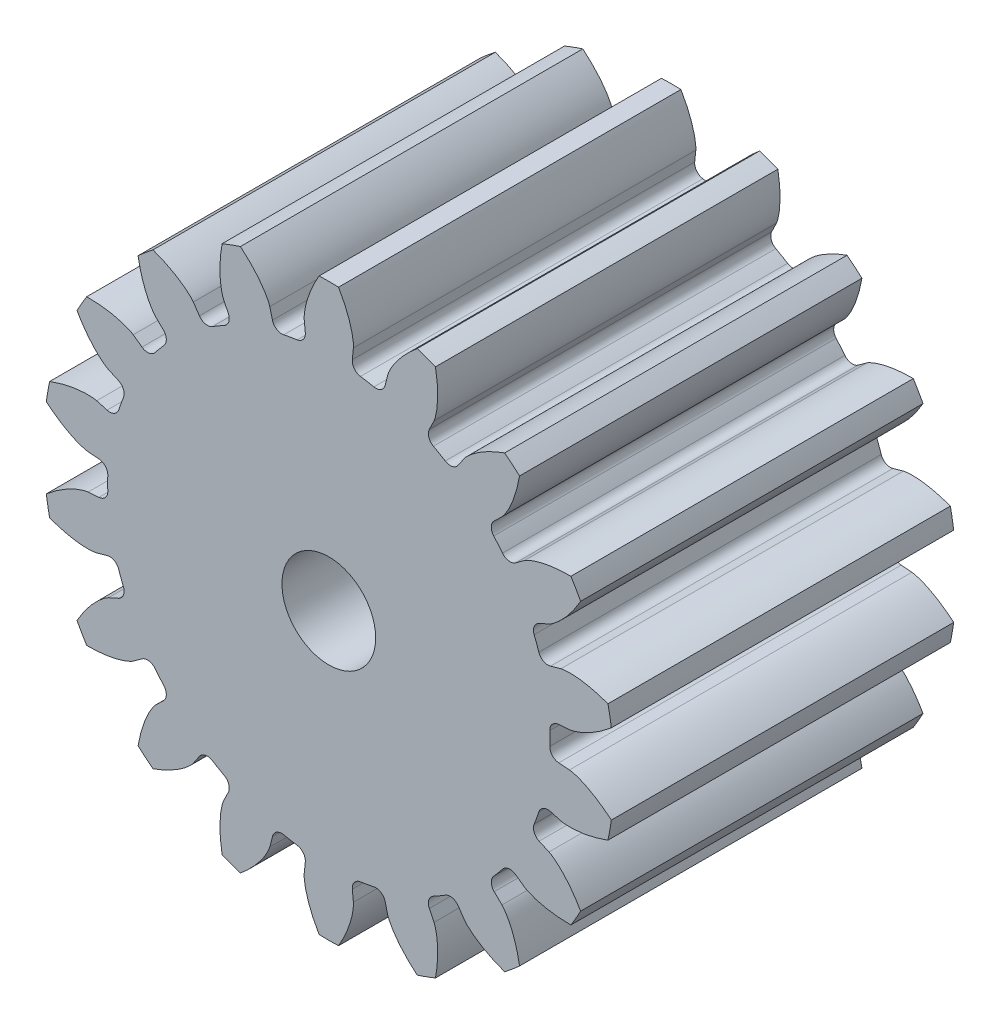
from build123d import *
from OCP.BRepAlgoAPI import BRepAlgoAPI_Cut
from OCP.TopTools import TopTools_ListOfShape

# Parameters (mm, degrees)
SKETCH3_R                = 10.583333333
BOSS_EXTRUDE1_DEPTH      = 12.7
CUT_EXTRUDE1_DEPTH       = 20.629159149
FILLET1_R                = 0.355076163
CIRPATTERN1_COUNT        = 18
FILLET1_OF_CIRPATTERN1_R = 0.355076163
SCALE1_SCALE             = 1.9
SKETCH6_R                = 3.302
CUT_EXTRUDE2_DEPTH       = 10.16
CUT_EXTRUDE3_DEPTH       = 3.048
SKETCH9_R                = 1.4605
CUT_EXTRUDE4_DEPTH       = 10.16


with BuildPart() as part:
    # Sketch3 → Boss-Extrude1 (new body)
    with BuildSketch(Plane.XY):
        Circle(SKETCH3_R)
    extrude(amount=-BOSS_EXTRUDE1_DEPTH)

    # Sketch4 → Cut-Extrude1 (cut, symmetric)
    with BuildSketch(Plane.XY):
        with BuildLine():
            Line((8.180618539, 0.593001964), (8.927148628, 0.647116919))
            add(Edge.make_bspline(
                [(8.927148628, 0.647116919), (8.929773603, 0.64734246), (8.937126743, 0.648083571), (8.950989701, 0.649913095), (8.97354406, 0.653505718), (9.002174883, 0.658974713), (9.039040294, 0.667064652), (9.08227108, 0.677905244), (9.129552823, 0.691187893), (9.180725702, 0.707111733), (9.231524372, 0.724296782), (9.281946361, 0.742644429), (9.331936661, 0.762005639), (9.392192531, 0.786734306), (9.464019144, 0.81815733), (9.547307729, 0.857451379), (9.640949476, 0.905033405), (9.735448155, 0.956729189), (9.827643658, 1.01022152), (9.919826595, 1.067258688), (10.008328253, 1.124562674), (10.099192996, 1.187113225), (10.182530598, 1.246394384), (10.274659666, 1.316128649), (10.348652098, 1.373376845), (10.424010343, 1.435256389), (10.460526963, 1.465776942), (10.479120716, 1.481544284)],
                knots=[0, 0, 0, 0, 0, 0.005376749, 0.015083688, 0.02853182, 0.04661014, 0.064854849, 0.092110526, 0.119476176, 0.146842496, 0.174208854, 0.201574956, 0.228941013, 0.256307345, 0.307035032, 0.361767352, 0.416499661, 0.471231937, 0.525964282, 0.580696616, 0.635428982, 0.690161387, 0.744893688, 0.799626082, 0.854358407, 0.909090915, 0.909090915, 0.909090915, 0.909090915, 0.909090915], degree=4))
            ThreePointArc((10.479120716, 1.481544284), (10.583333333, 0), (10.479120716, -1.481544284))
            add(Edge.make_bspline(
                [(8.927148628, -0.647116919), (8.929773603, -0.64734246), (8.937126743, -0.648083571), (8.950989701, -0.649913095), (8.97354406, -0.653505718), (9.002174883, -0.658974713), (9.039040294, -0.667064652), (9.08227108, -0.677905244), (9.129552823, -0.691187893), (9.180725702, -0.707111733), (9.231524372, -0.724296782), (9.281946361, -0.742644429), (9.331936661, -0.762005639), (9.392192531, -0.786734306), (9.464019144, -0.81815733), (9.547307729, -0.857451379), (9.640949476, -0.905033405), (9.735448155, -0.956729189), (9.827643658, -1.01022152), (9.919826595, -1.067258688), (10.008328253, -1.124562674), (10.099192996, -1.187113225), (10.182530598, -1.246394384), (10.274659666, -1.316128649), (10.348652098, -1.373376845), (10.424010343, -1.435256389), (10.460526963, -1.465776942), (10.479120716, -1.481544284)],
                knots=[0, 0, 0, 0, 0, 0.005376749, 0.015083688, 0.02853182, 0.04661014, 0.064854849, 0.092110526, 0.119476176, 0.146842496, 0.174208854, 0.201574956, 0.228941013, 0.256307345, 0.307035032, 0.361767352, 0.416499661, 0.471231937, 0.525964282, 0.580696616, 0.635428982, 0.690161387, 0.744893688, 0.799626082, 0.854358407, 0.909090915, 0.909090915, 0.909090915, 0.909090915, 0.909090915], degree=4))
            Line((8.927148628, -0.647116919), (8.180618539, -0.593001964))
            ThreePointArc((8.180618539, -0.593001964), (8.202083333, 0), (8.180618539, 0.593001964))
        make_face()
    cut_extrude1 = extrude(amount=CUT_EXTRUDE1_DEPTH, both=True, mode=Mode.SUBTRACT)

    # Fillet1
    fillet1_edges = [part.edges().sort_by_distance(p)[0] for p in [
        (8.180618539, -0.593001964, -6.35),
        (8.180618539, 0.593001964, -6.35),
    ]]
    fillet(fillet1_edges, radius=FILLET1_R)

    # CirPattern1: Cut-Extrude1 ×18 about axis
    cirpattern1_axis = Axis((0, 0, 6.35), (0, 0, -1))
    for i in range(1, CIRPATTERN1_COUNT):
        add(cut_extrude1.rotate(cirpattern1_axis, i * 360 / CIRPATTERN1_COUNT), mode=Mode.SUBTRACT)

    # Fillet1 of CirPattern1
    fillet1_of_cirpattern1_edges = [part.edges().sort_by_distance(p)[0] for p in [
        (7.484448258, -3.355175895, -6.35),
        (7.890085491, -2.240696756, -6.35),
        (5.885543058, -5.712666095, -6.35),
        (6.647891688, -4.804134377, -6.35),
        (3.576754504, -7.381124455, -6.35),
        (4.603864035, -6.788122491, -6.35),
        (0.83655657, -8.159310272, -6.35),
        (2.004542433, -7.953362851, -6.35),
        (-2.004542433, -7.953362851, -6.35),
        (-0.83655657, -8.159310272, -6.35),
        (-4.603864035, -6.788122491, -6.35),
        (-3.576754504, -7.381124455, -6.35),
        (-6.647891688, -4.804134377, -6.35),
        (-5.885543058, -5.712666095, -6.35),
        (-7.890085491, -2.240696756, -6.35),
        (-7.484448258, -3.355175895, -6.35),
        (-8.180618539, 0.593001964, -6.35),
        (-8.180618539, -0.593001964, -6.35),
        (-7.484448258, 3.355175895, -6.35),
        (-7.890085491, 2.240696756, -6.35),
        (-5.885543058, 5.712666095, -6.35),
        (-6.647891688, 4.804134377, -6.35),
        (-3.576754504, 7.381124455, -6.35),
        (-4.603864035, 6.788122491, -6.35),
        (-0.83655657, 8.159310272, -6.35),
        (-2.004542433, 7.953362851, -6.35),
        (2.004542433, 7.953362851, -6.35),
        (0.83655657, 8.159310272, -6.35),
        (4.603864035, 6.788122491, -6.35),
        (3.576754504, 7.381124455, -6.35),
        (6.647891688, 4.804134377, -6.35),
        (5.885543058, 5.712666095, -6.35),
        (7.890085491, 2.240696756, -6.35),
        (7.484448258, 3.355175895, -6.35),
    ]]
    fillet(fillet1_of_cirpattern1_edges, radius=FILLET1_OF_CIRPATTERN1_R)


with BuildPart() as part_1:
    # Scale1: scaled about (0, 0, -6.349999412)
    add(part.part.scale(SCALE1_SCALE).moved(Location((0, 0, 5.714999471))))


with BuildPart() as cut_extrude2_tool:
    # Sketch6 → Cut-Extrude2 (new body)
    with BuildSketch(Plane.XY.offset(5.71499769)):
        Circle(SKETCH6_R)
    extrude(amount=-CUT_EXTRUDE2_DEPTH)


with BuildPart() as part_2:
    add(part_1.part)

    # Cut-Extrude2: cut by cut_extrude2_tool, with a tolerance
    cut_extrude2_stock = TopTools_ListOfShape()
    cut_extrude2_stock.Append(part_2.part.wrapped)
    cut_extrude2_tools = TopTools_ListOfShape()
    cut_extrude2_tools.Append(cut_extrude2_tool.part.wrapped)
    cut_extrude2_cut = BRepAlgoAPI_Cut()
    cut_extrude2_cut.SetArguments(cut_extrude2_stock)
    cut_extrude2_cut.SetTools(cut_extrude2_tools)
    cut_extrude2_cut.SetFuzzyValue(0.00001)
    cut_extrude2_cut.Build()
    add(Compound.cast(cut_extrude2_cut.Shape()).solids(), mode=Mode.REPLACE)

    # Sketch8 → Cut-Extrude3 (cut)
    with BuildSketch(Plane(origin=(0, 0, -18.41500231), x_dir=(-1, 0, 0), z_dir=(0, 0, -1))):
        Polygon((-8.130443212, 0), (-9.780221606, 2.8575), (-13.079778394, 2.8575), (-14.729556788, 0), (-13.079778394, -2.8575), (-9.780221606, -2.8575), align=None)
        Polygon((14.729556788, 0.021745977), (13.079778394, 2.879245977), (9.780221606, 2.879245977), (8.130443212, 0.021745977), (9.780221606, -2.835754023), (13.079778394, -2.835754023), align=None)
    extrude(amount=-CUT_EXTRUDE3_DEPTH, mode=Mode.SUBTRACT)

    # Sketch9 → Cut-Extrude4 (cut)
    with BuildSketch(Plane(origin=(0, 0, -15.36700231), x_dir=(-1, 0, 0), z_dir=(0, 0, -1))):
        with Locations((-11.43, 0)):
            Circle(SKETCH9_R)
        with Locations((11.43, 0)):
            Circle(SKETCH9_R)
    extrude(amount=-CUT_EXTRUDE4_DEPTH, mode=Mode.SUBTRACT)


solid = part_2.part
